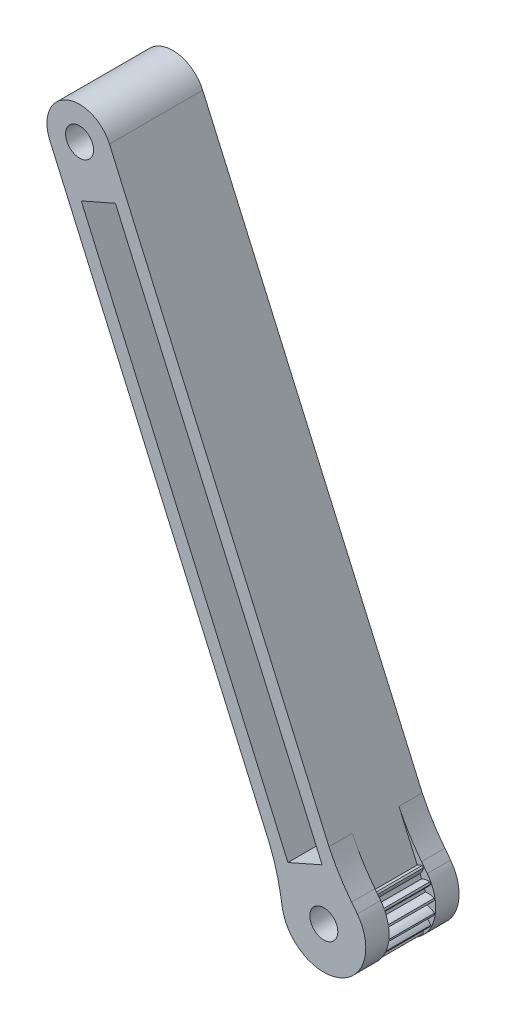
from build123d import *

# Parameters (mm, degrees)
BOSS_EXTRUDE1_DEPTH                       = 10
BOSS_EXTRUDE1_DEPTH_BACK                  = 10
SKETCH1_R                                 = 3
CUT_EXTRUDE1_START                        = -1.5
CUT_EXTRUDE1_DEPTH                        = 8.5
CUT_EXTRUDE2_START                        = 1.5
CUT_EXTRUDE2_DEPTH                        = 8.5
ISO_START                                 = -65.353403805
ISO_SPUR_GEAR_0_8M_20T_20PA_10FW_2_R      = 3
ISO_SPUR_GEAR_0_8M_20T_20PA_10FW_S2_DEPTH = 10
BODY_MOVE_COPY5_ANGLE                     = 90
BOSS_EXTRUDE3_START                       = 5
BOSS_EXTRUDE3_DEPTH                       = 5
BOSS_EXTRUDE4_START                       = -10
BOSS_EXTRUDE4_DEPTH                       = 5


with BuildPart() as part:
    # Sketch1 → Boss-Extrude1 (new, two sides: drawn at the far end of the back side and taken through both)
    with BuildSketch(Plane.XY.offset(-BOSS_EXTRUDE1_DEPTH_BACK)):
        with BuildLine():
            Line((-43.593099474, 20.819862701), (-95.961978206, 139.805158181))
            ThreePointArc((-95.961978206, 139.805158181), (-105.188741432, 143.392196006), (-108.775779257, 134.165432779))
            Line((-108.775779257, 134.165432779), (-56.406900526, 15.180137299))
            ThreePointArc((-56.406900526, 15.180137299), (-47.180137299, 11.593099474), (-43.593099474, 20.819862701))
        make_face()
        with Locations((-102.368878731, 136.98529548)):
            Circle(SKETCH1_R, mode=Mode.SUBTRACT)
        with Locations((-50, 18)):
            Circle(SKETCH1_R, mode=Mode.SUBTRACT)
    extrude(amount=BOSS_EXTRUDE1_DEPTH + BOSS_EXTRUDE1_DEPTH_BACK)

    # Sketch3 → Cut-Extrude1 (cut)
    with BuildSketch(Plane.XY.offset(CUT_EXTRUDE1_START)):
        Polygon((-102.001589459, 126.221230328), (-94.67941743, 129.443930558), (-50.367289272, 28.764065152), (-57.689461302, 25.541364922), align=None)
    extrude(amount=-CUT_EXTRUDE1_DEPTH, mode=Mode.SUBTRACT)

    # Sketch3<2> → Cut-Extrude2 (cut)
    with BuildSketch(Plane.XY.offset(CUT_EXTRUDE2_START)):
        Polygon((-102.001589459, 126.221230328), (-94.67941743, 129.443930558), (-50.367289272, 28.764065152), (-57.689461302, 25.541364922), align=None)
    extrude(amount=CUT_EXTRUDE2_DEPTH, mode=Mode.SUBTRACT)


with BuildPart() as body_2:
    # ISO - Spur gear 0.8M 20T 20PA 10FW ---S2: read off the stored shape, not the designer's step
    # ISO - Spur gear 0.8M 20T 20PA 10FW - 2 → ISO - Spur gear 0.8M 20T 20PA 10FW ---S2 (new body)
    with BuildSketch(Plane.YZ.offset(ISO_START)):
        with BuildLine():
            ThreePointArc((13.061118754, 13.065363156), (12.856461697, 13.100257159), (12.65103843, 13.130313498))
            ThreePointArc((12.65103843, 13.130313498), (12.133552117, 12.321807494), (11.879141065, 11.396200093))
            ThreePointArc((11.879141065, 11.396200093), (11.479838405, 11.407599762), (11.080535745, 11.396200093))
            ThreePointArc((11.080535745, 11.396200093), (10.826124693, 12.321807494), (10.30863838, 13.130313498))
            ThreePointArc((10.30863838, 13.130313498), (10.103215113, 13.100257159), (9.898558056, 13.065363156))
            ThreePointArc((9.898558056, 13.065363156), (9.656241422, 12.136516187), (9.70031055, 11.177593898))
            ThreePointArc((9.70031055, 11.177593898), (9.317028462, 11.065044319), (8.940791756, 10.930811282))
            ThreePointArc((8.940791756, 10.930811282), (8.41280405, 11.732498893), (7.670803225, 12.341521733))
            ThreePointArc((7.670803225, 12.341521733), (7.484722007, 12.249457175), (7.30086442, 12.153028497))
            ThreePointArc((7.30086442, 12.153028497), (7.357437105, 11.194762576), (7.695672619, 10.296391394))
            ThreePointArc((7.695672619, 10.296391394), (7.365929424, 10.070909706), (7.049587344, 9.826982965))
            ThreePointArc((7.049587344, 9.826982965), (6.299706099, 10.426276017), (5.405822972, 10.776200293))
            ThreePointArc((5.405822972, 10.776200293), (5.257298731, 10.631139436), (5.112237874, 10.482615195))
            ThreePointArc((5.112237874, 10.482615195), (5.46216215, 9.588732068), (6.061455202, 8.838850823))
            ThreePointArc((6.061455202, 8.838850823), (5.817528461, 8.522508743), (5.592046773, 8.192765548))
            ThreePointArc((5.592046773, 8.192765548), (4.693675591, 8.531001062), (3.73540967, 8.587573747))
            ThreePointArc((3.73540967, 8.587573747), (3.638980992, 8.40371616), (3.546916434, 8.217634942))
            ThreePointArc((3.546916434, 8.217634942), (4.155939274, 7.475634117), (4.957626885, 6.947646411))
            ThreePointArc((4.957626885, 6.947646411), (4.823393847, 6.571409706), (4.710844269, 6.188127617))
            ThreePointArc((4.710844269, 6.188127617), (3.75192198, 6.232196745), (2.823075011, 5.989880111))
            ThreePointArc((2.823075011, 5.989880111), (2.788181008, 5.785223054), (2.758124669, 5.579799787))
            ThreePointArc((2.758124669, 5.579799787), (3.566630673, 5.062313474), (4.492238074, 4.807902422))
            ThreePointArc((4.492238074, 4.807902422), (4.480838405, 4.408599762), (4.492238074, 4.009297102))
            ThreePointArc((4.492238074, 4.009297102), (3.566630673, 3.75488605), (2.758124669, 3.237399737))
            ThreePointArc((2.758124669, 3.237399737), (2.788181008, 3.03197647), (2.823075011, 2.827319413))
            ThreePointArc((2.823075011, 2.827319413), (3.75192198, 2.585002779), (4.710844269, 2.629071907))
            ThreePointArc((4.710844269, 2.629071907), (4.823393847, 2.245789818), (4.957626885, 1.869553113))
            ThreePointArc((4.957626885, 1.869553113), (4.155939274, 1.341565407), (3.546916434, 0.599564582))
            ThreePointArc((3.546916434, 0.599564582), (3.638980992, 0.413483364), (3.73540967, 0.229625777))
            ThreePointArc((3.73540967, 0.229625777), (4.693675591, 0.286198462), (5.592046773, 0.624433976))
            ThreePointArc((5.592046773, 0.624433976), (5.817528461, 0.294690781), (6.061455202, -0.021651299))
            ThreePointArc((6.061455202, -0.021651299), (5.46216215, -0.771532544), (5.112237874, -1.665415671))
            ThreePointArc((5.112237874, -1.665415671), (5.257298731, -1.813939912), (5.405822972, -1.959000769))
            ThreePointArc((5.405822972, -1.959000769), (6.299706099, -1.609076494), (7.049587344, -1.009783441))
            ThreePointArc((7.049587344, -1.009783441), (7.365929424, -1.253710182), (7.695672619, -1.479191871))
            ThreePointArc((7.695672619, -1.479191871), (7.357437105, -2.377563053), (7.30086442, -3.335828973))
            ThreePointArc((7.30086442, -3.335828973), (7.484722007, -3.432257651), (7.670803225, -3.524322209))
            ThreePointArc((7.670803225, -3.524322209), (8.41280405, -2.915299369), (8.940791756, -2.113611758))
            ThreePointArc((8.940791756, -2.113611758), (9.317028461, -2.247844796), (9.70031055, -2.360394374))
            ThreePointArc((9.70031055, -2.360394374), (9.656241422, -3.319316663), (9.898558056, -4.248163632))
            ThreePointArc((9.898558056, -4.248163632), (10.103215113, -4.283057635), (10.30863838, -4.313113975))
            ThreePointArc((10.30863838, -4.313113975), (10.826124693, -3.50460797), (11.080535745, -2.579000569))
            ThreePointArc((11.080535745, -2.579000569), (11.479838405, -2.590400238), (11.879141065, -2.579000569))
            ThreePointArc((11.879141065, -2.579000569), (12.133552117, -3.50460797), (12.65103843, -4.313113975))
            ThreePointArc((12.65103843, -4.313113975), (12.856461697, -4.283057635), (13.061118754, -4.248163632))
            ThreePointArc((13.061118754, -4.248163632), (13.303435388, -3.319316663), (13.25936626, -2.360394374))
            ThreePointArc((13.25936626, -2.360394374), (13.642648349, -2.247844796), (14.018885054, -2.113611758))
            ThreePointArc((14.018885054, -2.113611758), (14.54687276, -2.915299369), (15.288873585, -3.524322209))
            ThreePointArc((15.288873585, -3.524322209), (15.474954803, -3.432257651), (15.65881239, -3.335828973))
            ThreePointArc((15.65881239, -3.335828973), (15.602239705, -2.377563053), (15.264004191, -1.479191871))
            ThreePointArc((15.264004191, -1.479191871), (15.593747386, -1.253710182), (15.910089466, -1.009783441))
            ThreePointArc((15.910089466, -1.009783441), (16.659970711, -1.609076494), (17.553853838, -1.959000769))
            ThreePointArc((17.553853838, -1.959000769), (17.702378079, -1.813939912), (17.847438936, -1.665415671))
            ThreePointArc((17.847438936, -1.665415671), (17.49751466, -0.771532544), (16.898221608, -0.021651299))
            ThreePointArc((16.898221608, -0.021651299), (17.142148349, 0.294690781), (17.367630037, 0.624433976))
            ThreePointArc((17.367630037, 0.624433976), (18.266001219, 0.286198462), (19.22426714, 0.229625777))
            ThreePointArc((19.22426714, 0.229625777), (19.320695818, 0.413483364), (19.412760376, 0.599564582))
            ThreePointArc((19.412760376, 0.599564582), (18.803737536, 1.341565407), (18.002049925, 1.869553113))
            ThreePointArc((18.002049925, 1.869553113), (18.136282963, 2.245789818), (18.248832541, 2.629071907))
            ThreePointArc((18.248832541, 2.629071907), (19.20775483, 2.585002779), (20.136601799, 2.827319413))
            ThreePointArc((20.136601799, 2.827319413), (20.171495802, 3.03197647), (20.201552142, 3.237399737))
            ThreePointArc((20.201552142, 3.237399737), (19.393046137, 3.75488605), (18.467438736, 4.009297102))
            ThreePointArc((18.467438736, 4.009297102), (18.478838405, 4.408599762), (18.467438736, 4.807902422))
            ThreePointArc((18.467438736, 4.807902422), (19.393046137, 5.062313474), (20.201552142, 5.579799787))
            ThreePointArc((20.201552142, 5.579799787), (20.171495802, 5.785223054), (20.136601799, 5.989880111))
            ThreePointArc((20.136601799, 5.989880111), (19.20775483, 6.232196745), (18.248832541, 6.188127617))
            ThreePointArc((18.248832541, 6.188127617), (18.136282963, 6.571409706), (18.002049925, 6.947646411))
            ThreePointArc((18.002049925, 6.947646411), (18.803737536, 7.475634117), (19.412760376, 8.217634942))
            ThreePointArc((19.412760376, 8.217634942), (19.320695818, 8.40371616), (19.22426714, 8.587573747))
            ThreePointArc((19.22426714, 8.587573747), (18.266001219, 8.531001062), (17.367630037, 8.192765548))
            ThreePointArc((17.367630037, 8.192765548), (17.142148349, 8.522508743), (16.898221608, 8.838850823))
            ThreePointArc((16.898221608, 8.838850823), (17.49751466, 9.588732068), (17.847438936, 10.482615195))
            ThreePointArc((17.847438936, 10.482615195), (17.702378079, 10.631139436), (17.553853838, 10.776200293))
            ThreePointArc((17.553853838, 10.776200293), (16.659970711, 10.426276017), (15.910089466, 9.826982965))
            ThreePointArc((15.910089466, 9.826982965), (15.593747386, 10.070909706), (15.264004191, 10.296391394))
            ThreePointArc((15.264004191, 10.296391394), (15.602239705, 11.194762576), (15.65881239, 12.153028497))
            ThreePointArc((15.65881239, 12.153028497), (15.474954803, 12.249457175), (15.288873585, 12.341521733))
            ThreePointArc((15.288873585, 12.341521733), (14.54687276, 11.732498893), (14.018885054, 10.930811282))
            ThreePointArc((14.018885054, 10.930811282), (13.642648348, 11.065044319), (13.25936626, 11.177593898))
            ThreePointArc((13.25936626, 11.177593898), (13.303435388, 12.136516187), (13.061118754, 13.065363156))
        make_face()
        with Locations((11.479838405, 4.408599762)):
            Circle(ISO_SPUR_GEAR_0_8M_20T_20PA_10FW_2_R, mode=Mode.SUBTRACT)
    extrude(amount=ISO_SPUR_GEAR_0_8M_20T_20PA_10FW_S2_DEPTH)


with BuildPart() as body_2_1:
    # Body-Move/Copy5: read off the stored shape, not the designer's step
    # Body-Move/Copy5: moved
    add(body_2.part.moved(Location((60.3534038, 6.5201616, 45.5914002))).rotate(Axis((0, 0, 0), (0, -1, 0)), BODY_MOVE_COPY5_ANGLE))


with BuildPart() as part_1:
    add(part.part)

    # Combine1: union body 2
    add(body_2_1.part)

    # Sketch12 → Boss-Extrude3 (add)
    with BuildSketch(Plane.XY.offset(BOSS_EXTRUDE3_START)):
        with BuildLine():
            Line((-48.891620836, 32.858427304), (-43.593099474, 20.819862701))
            ThreePointArc((-43.593099474, 20.819862701), (-47.180137299, 11.593099474), (-56.406900526, 15.180137299))
            Line((-56.406900526, 15.180137299), (-61.705421887, 27.218701903))
            ThreePointArc((-61.705421887, 27.218701903), (-60.19239704, 22.855047235), (-59.192458109, 18.34607303))
            ThreePointArc((-59.192458109, 18.34607303), (-59.027479347, 17.359761867), (-58.852127503, 16.375241967))
            ThreePointArc((-58.852127503, 16.375241967), (-46.374462242, 9.762556467), (-42.82276978, 23.430227101))
            ThreePointArc((-42.82276978, 23.430227101), (-43.430325673, 24.224521466), (-44.0462089, 25.012376499))
            ThreePointArc((-44.0462089, 25.012376499), (-46.695775375, 28.795301788), (-48.891620836, 32.858427304))
        make_face()
    extrude(amount=BOSS_EXTRUDE3_DEPTH)

    # Sketch12<9> → Boss-Extrude4 (add)
    with BuildSketch(Plane.XY.offset(BOSS_EXTRUDE4_START)):
        with BuildLine():
            Line((-48.891620836, 32.858427304), (-43.593099474, 20.819862701))
            ThreePointArc((-43.593099474, 20.819862701), (-47.180137299, 11.593099474), (-56.406900526, 15.180137299))
            Line((-56.406900526, 15.180137299), (-61.705421887, 27.218701903))
            ThreePointArc((-61.705421887, 27.218701903), (-60.19239704, 22.855047235), (-59.192458109, 18.34607303))
            ThreePointArc((-59.192458109, 18.34607303), (-59.027479347, 17.359761867), (-58.852127503, 16.375241967))
            ThreePointArc((-58.852127503, 16.375241967), (-46.374462242, 9.762556467), (-42.82276978, 23.430227101))
            ThreePointArc((-42.82276978, 23.430227101), (-43.430325673, 24.224521466), (-44.0462089, 25.012376499))
            ThreePointArc((-44.0462089, 25.012376499), (-46.695775375, 28.795301788), (-48.891620836, 32.858427304))
        make_face()
    extrude(amount=BOSS_EXTRUDE4_DEPTH)


solid = part_1.part
